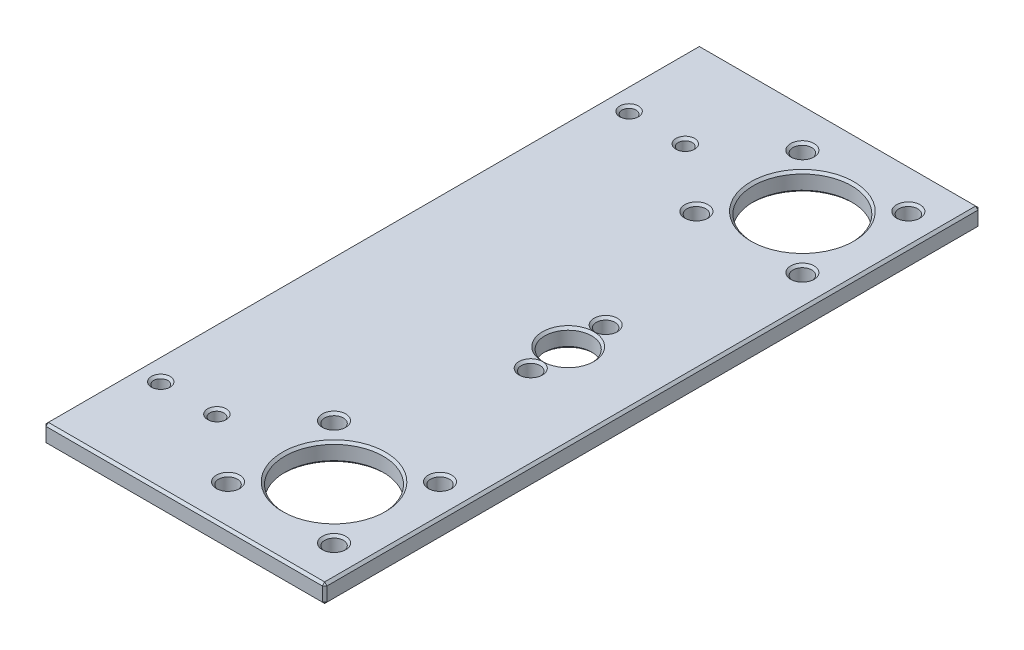
from build123d import *

# Parameters (mm, degrees)
CROQUIS1_W              = 60
CROQUIS1_H              = 140
CROQUIS1_R              = 2
CROQUIS1_R_2            = 5
CROQUIS1_R_3            = 10.5
CROQUIS1_R_4            = 1.5
SALIENTE_EXTRUIR1_DEPTH = 4
CHAFL_N1_SIZE           = 0.5


with BuildPart() as part:
    # Croquis1 → Saliente-Extruir1 (new body)
    with BuildSketch(Plane(origin=(0, 0, 0), x_dir=(1, 0, 0), z_dir=(0, 1, 0))):
        with Locations((-8.728313692, -1.041413592)):
            Rectangle(CROQUIS1_W, CROQUIS1_H)
        with Locations(Location((3.271686308, 6.958586408, 0), (0, 0, 270))):
            Circle(CROQUIS1_R, mode=Mode.SUBTRACT)
        with Locations(Location((3.271686308, -9.041413592, 0), (0, 0, 270))):
            Circle(CROQUIS1_R, mode=Mode.SUBTRACT)
        with Locations(Location((14.585394807, 60.272294907, 0), (0, 0, 270))):
            Circle(CROQUIS1_R, mode=Mode.SUBTRACT)
        with Locations(Location((14.585394807, -39.727705093, 0), (0, 0, 270))):
            Circle(CROQUIS1_R, mode=Mode.SUBTRACT)
        with Locations(Location((-8.042022191, -39.727705093, 0), (0, 0, 90))):
            Circle(CROQUIS1_R, mode=Mode.SUBTRACT)
        with Locations(Location((-8.042022191, -62.355122091, 0), (0, 0, 270))):
            Circle(CROQUIS1_R, mode=Mode.SUBTRACT)
        with Locations(Location((3.271686308, -1.041413592, 0), (0, 0, 270))):
            Circle(CROQUIS1_R_2, mode=Mode.SUBTRACT)
        with Locations(Location((14.585394807, -62.355122091, 0), (0, 0, 90))):
            Circle(CROQUIS1_R, mode=Mode.SUBTRACT)
        with Locations(Location((3.271686308, -51.041413592, 0), (0, 0, 270))):
            Circle(CROQUIS1_R_3, mode=Mode.SUBTRACT)
        with Locations(Location((3.271686308, 48.958586408, 0), (0, 0, 270))):
            Circle(CROQUIS1_R_3, mode=Mode.SUBTRACT)
        with Locations(Location((-8.042022191, 60.272294907, 0), (0, 0, 90))):
            Circle(CROQUIS1_R, mode=Mode.SUBTRACT)
        with Locations(Location((14.585394807, 37.644877909, 0), (0, 0, 90))):
            Circle(CROQUIS1_R, mode=Mode.SUBTRACT)
        with Locations(Location((-8.042022191, 37.644877909, 0), (0, 0, 270))):
            Circle(CROQUIS1_R, mode=Mode.SUBTRACT)
        with Locations(Location((-21.728313692, -51.041413592, 0), (0, 0, 270))):
            Circle(CROQUIS1_R_4, mode=Mode.SUBTRACT)
        with Locations(Location((-33.728313692, -51.041413592, 0), (0, 0, 270))):
            Circle(CROQUIS1_R_4, mode=Mode.SUBTRACT)
        with Locations(Location((-21.728313692, 48.958586408, 0), (0, 0, 90))):
            Circle(CROQUIS1_R_4, mode=Mode.SUBTRACT)
        with Locations(Location((-33.728313692, 48.958586408, 0), (0, 0, 90))):
            Circle(CROQUIS1_R_4, mode=Mode.SUBTRACT)
    extrude(amount=SALIENTE_EXTRUIR1_DEPTH)

    # Chaflán1
    chafl_n1_edges = [part.edges().sort_by_distance(p)[0] for p in [
        (21.271686308, 4, 1.041413592),
        (3.271686308, 0, -8.958586408),
        (3.271686308, 4, -8.958586408),
        (-8.728313692, 4, -68.958586408),
        (3.271686308, 0, 7.041413592),
        (3.271686308, 4, 7.041413592),
        (14.585394807, 0, 37.727705093),
        (14.585394807, 4, 37.727705093),
        (-8.042022191, 0, 41.727705093),
        (-8.042022191, 4, 41.727705093),
        (3.271686308, 0, -3.958586408),
        (3.271686308, 4, -3.958586408),
        (-8.042022191, 0, 60.355122091),
        (-8.042022191, 4, 60.355122091),
        (3.271686308, 0, 40.541413592),
        (3.271686308, 4, 40.541413592),
        (3.271686308, 0, -59.458586408),
        (3.271686308, 4, -59.458586408),
        (-38.728313692, 4, 1.041413592),
        (14.585394807, 0, 64.355122091),
        (14.585394807, 4, 64.355122091),
        (-8.728313692, 0, -68.958586408),
        (14.585394807, 0, -62.272294907),
        (14.585394807, 4, -62.272294907),
        (21.271686308, 0, 1.041413592),
        (-8.042022191, 0, -58.272294907),
        (-8.042022191, 4, -58.272294907),
        (-8.728313692, 0, 71.041413592),
        (14.585394807, 0, -35.644877909),
        (14.585394807, 4, -35.644877909),
        (-38.728313692, 0, 1.041413592),
        (-8.042022191, 0, -39.644877909),
        (-8.042022191, 4, -39.644877909),
        (-21.728313692, 0, 49.541413592),
        (-21.728313692, 4, 49.541413592),
        (-33.728313692, 0, 49.541413592),
        (-33.728313692, 4, 49.541413592),
        (-21.728313692, 0, -47.458586408),
        (-21.728313692, 4, -47.458586408),
        (-8.728313692, 4, 71.041413592),
        (-33.728313692, 0, -47.458586408),
        (-33.728313692, 4, -47.458586408),
        (-38.728313692, 2, -68.958586408),
        (21.271686308, 2, -68.958586408),
        (21.271686308, 2, 71.041413592),
        (-38.728313692, 2, 71.041413592),
    ]]
    chamfer(chafl_n1_edges, length=CHAFL_N1_SIZE - 0.0001)  # a hair under: the kernel refuses the full size


solid = part.part
